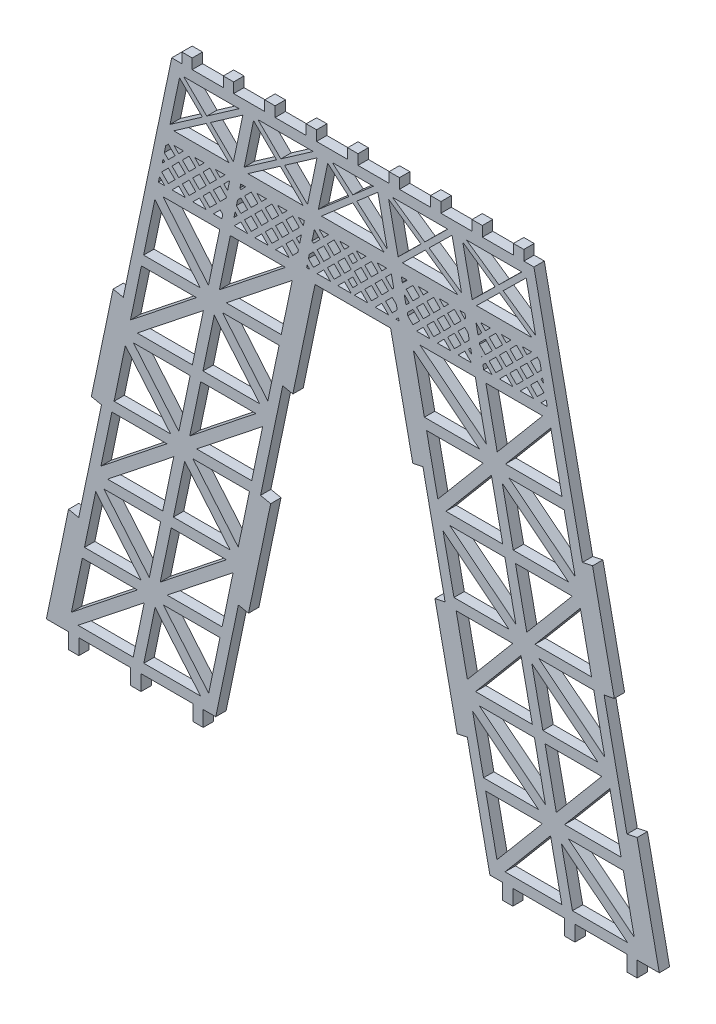
from build123d import *

# Parameters (mm, degrees)
BOSS_EXTRUDE1_DEPTH = 3


with BuildPart() as part:
    # Sketch1 → Boss-Extrude1 (new body)
    with BuildSketch(Plane.XY):
        Polygon((361.579902994, 294.067183599), (358.644817007, 294.067183599), (358.644817007, 297), (355.644817007, 297), (355.644817007, 294.067183598), (346.644817007, 294.067183598), (346.644817007, 297), (343.644817007, 297), (343.644817007, 294.067183598), (334.644817007, 294.067183598), (334.644817007, 297), (331.644817007, 297), (331.644817007, 294.067183598), (322.644817007, 294.067183598), (322.644817007, 297), (319.644817007, 297), (319.644817007, 294.067183598), (310.644817007, 294.067183598), (310.644817007, 297), (307.644817007, 297), (307.644817007, 294.067183598), (298.644817007, 294.067183598), (298.644817007, 297), (295.644817007, 297), (295.644817007, 294.067183598), (286.644817007, 294.067183598), (286.644817007, 297), (283.644817007, 297), (283.644817007, 294.067183598), (274.644817007, 294.067183598), (274.644817007, 297), (271.644817007, 297), (271.644817007, 294.067183599), (262.644817007, 294.067183599), (262.644817007, 297), (259.644817007, 297), (259.644817007, 294.067183599), (256.709731019, 294.067183599), (242.684226302, 227.008009418), (239.747765455, 227.622173639), (233.452582189, 197.523449951), (236.389043037, 196.90928573), (229.786777661, 165.342331618), (226.850316814, 165.956495839), (220.426680383, 135.24360793), (226.839180383, 135.24360793), (226.839180383, 130.74360793), (229.839180383, 130.74360793), (229.839180383, 135.24360793), (244.839180383, 135.24360793), (244.839180383, 130.74360793), (247.839180384, 130.74360793), (247.839180384, 135.24360793), (262.839180383, 135.24360793), (262.839180383, 130.74360793), (265.839180383, 130.74360793), (265.839180383, 135.24360793), (269.465304589, 135.24360793), (276.012418501, 166.546870169), (278.948879348, 165.932705948), (285.367540095, 196.621803965), (282.431079247, 197.235968186), (288.849739994, 227.925066204), (291.786200841, 227.310901983), (298.204861588, 258), (320.084772425, 258), (326.503433172, 227.310901983), (329.439894019, 227.925066204), (335.858554766, 197.235968186), (332.922093918, 196.621803965), (339.340754665, 165.932705948), (342.277215512, 166.546870169), (348.824329424, 135.24360793), (352.450453629, 135.24360793), (352.450453629, 130.74360793), (355.450453629, 130.74360793), (355.450453629, 135.24360793), (370.450453629, 135.24360793), (370.450453629, 130.74360793), (373.450453629, 130.74360793), (373.450453629, 135.24360793), (388.450453629, 135.24360793), (388.450453629, 130.74360793), (391.450453629, 130.74360793), (391.450453629, 135.24360793), (397.862953629, 135.24360793), (391.439317199, 165.956495839), (388.502856351, 165.342331618), (381.900590976, 196.90928573), (384.837051823, 197.523449951), (378.541868558, 227.622173639), (375.605407711, 227.008009418), align=None)
        Polygon((245.573445995, 138.24360793), (229.596770487, 138.24360793), (248.753537524, 153.448359276), align=None, mode=Mode.SUBTRACT)
        Polygon((246.768595166, 155.703006608), (227.664221537, 140.539839979), (230.835615573, 155.703006608), align=None, mode=Mode.SUBTRACT)
        Polygon((265.067303387, 138.24360793), (248.638360008, 138.24360793), (251.908473596, 153.878775512), align=None, mode=Mode.SUBTRACT)
        Polygon((254.294250277, 155.703006608), (270.67949774, 155.703006608), (267.418081645, 140.109423744), align=None, mode=Mode.SUBTRACT)
        Polygon((247.848316546, 158.703006608), (231.463069083, 158.703006608), (234.724485178, 174.296589473), align=None, mode=Mode.SUBTRACT)
        Polygon((237.075263436, 176.162405287), (253.504206815, 176.162405287), (250.234093227, 160.527237705), align=None, mode=Mode.SUBTRACT)
        Polygon((253.389029299, 160.95765394), (256.569120828, 176.162405287), (272.545796335, 176.162405287), align=None, mode=Mode.SUBTRACT)
        Polygon((274.478345286, 173.866173237), (271.306951249, 158.703006608), (255.373971657, 158.703006608), align=None, mode=Mode.SUBTRACT)
        Polygon((238.154984816, 179.162405287), (257.311751853, 194.367156633), (254.131660324, 179.162405287), align=None, mode=Mode.SUBTRACT)
        Polygon((255.326809495, 196.621803965), (236.222435866, 181.458637336), (239.393829902, 196.621803965), align=None, mode=Mode.SUBTRACT)
        Polygon((256.406530875, 199.621803965), (240.021283411, 199.621803965), (243.282699507, 215.21538683), align=None, mode=Mode.SUBTRACT)
        Polygon((245.633477765, 217.081202644), (262.062421144, 217.081202644), (258.792307556, 201.446035062), align=None, mode=Mode.SUBTRACT)
        Polygon((273.625517716, 179.162405287), (257.196574337, 179.162405287), (260.466687925, 194.797572868), align=None, mode=Mode.SUBTRACT)
        Polygon((279.237712069, 196.621803965), (275.976295974, 181.028221101), (262.852464606, 196.621803965), align=None, mode=Mode.SUBTRACT)
        Polygon((283.036559615, 214.784970594), (279.865165578, 199.621803965), (263.932185986, 199.621803965), align=None, mode=Mode.SUBTRACT)
        Polygon((261.947243628, 201.876451297), (265.127335157, 217.081202643), (281.104010664, 217.081202643), align=None, mode=Mode.SUBTRACT)
        Polygon((362.915662355, 158.703006608), (346.982682763, 158.703006608), (343.811288727, 173.866173237), align=None, mode=Mode.SUBTRACT)
        Polygon((366.381160417, 153.878775511), (369.651274005, 138.24360793), (353.222330625, 138.24360793), align=None, mode=Mode.SUBTRACT)
        Polygon((347.610136272, 155.703006608), (363.995383736, 155.703006608), (350.871552368, 140.109423744), align=None, mode=Mode.SUBTRACT)
        Polygon((372.716188017, 138.24360793), (369.536096489, 153.448359276), (388.692863525, 138.24360793), align=None, mode=Mode.SUBTRACT)
        Polygon((390.625412475, 140.539839979), (371.521038847, 155.703006608), (387.454018439, 155.703006608), align=None, mode=Mode.SUBTRACT)
        Polygon((345.743837677, 176.162405287), (361.720513185, 176.162405287), (364.900604713, 160.95765394), align=None, mode=Mode.SUBTRACT)
        Polygon((368.055540785, 160.527237705), (364.785427198, 176.162405286), (381.214370577, 176.162405286), align=None, mode=Mode.SUBTRACT)
        Polygon((386.82656493, 158.703006608), (370.441317466, 158.703006608), (383.565148834, 174.296589472), align=None, mode=Mode.SUBTRACT)
        Polygon((357.822946088, 194.797572868), (361.093059676, 179.162405286), (344.664116297, 179.162405286), align=None, mode=Mode.SUBTRACT)
        Polygon((339.051921944, 196.621803965), (355.437169407, 196.621803965), (342.313338039, 181.0282211), align=None, mode=Mode.SUBTRACT)
        Polygon((354.357448027, 199.621803965), (338.424468435, 199.621803965), (335.253074398, 214.784970594), align=None, mode=Mode.SUBTRACT)
        Polygon((337.185623348, 217.081202643), (353.162298856, 217.081202643), (356.342390385, 201.876451297), align=None, mode=Mode.SUBTRACT)
        Polygon((364.157973689, 179.162405286), (360.97788216, 194.367156633), (380.134649196, 179.162405286), align=None, mode=Mode.SUBTRACT)
        Polygon((382.067198147, 181.458637336), (362.962824518, 196.621803965), (378.89580411, 196.621803965), align=None, mode=Mode.SUBTRACT)
        Polygon((359.497326457, 201.446035062), (356.227212869, 217.081202643), (372.656156248, 217.081202643), align=None, mode=Mode.SUBTRACT)
        Polygon((378.268350601, 199.621803965), (361.883103138, 199.621803965), (375.006934506, 215.215386829), align=None, mode=Mode.SUBTRACT)
        Polygon((246.713199145, 220.081202644), (265.869966181, 235.28595399), (262.689874653, 220.081202644), align=None, mode=Mode.SUBTRACT)
        Polygon((263.885023824, 237.540601322), (244.780650195, 222.377434693), (247.952044231, 237.540601322), align=None, mode=Mode.SUBTRACT)
        Polygon((264.964745204, 240.540601322), (248.57949774, 240.540601322), (251.840913836, 256.134184186), align=None, mode=Mode.SUBTRACT)
        Polygon((254.191692094, 258), (270.620635473, 258), (267.350521885, 242.364832419), align=None, mode=Mode.SUBTRACT)
        Polygon((282.183732045, 220.081202643), (265.754788666, 220.081202643), (269.024902253, 235.716370225), align=None, mode=Mode.SUBTRACT)
        Polygon((287.795926398, 237.540601322), (284.534510302, 221.947018457), (271.410678934, 237.540601322), align=None, mode=Mode.SUBTRACT)
        Polygon((291.594773943, 255.703767951), (288.423379907, 240.540601322), (272.490400315, 240.540601322), align=None, mode=Mode.SUBTRACT)
        Polygon((270.505457957, 242.795248654), (273.685549485, 258), (289.662224993, 258), align=None, mode=Mode.SUBTRACT)
        Polygon((252.858604905, 261), (253.17392681, 262.507626783), (254.681553592, 261), align=None, mode=Mode.SUBTRACT)
        Polygon((260.681553592, 261), (256.802873936, 261), (258.742213764, 262.939339828), align=None, mode=Mode.SUBTRACT)
        Polygon((253.802873936, 264), (255.742213764, 265.939339828), (257.681553592, 264), (255.742213764, 262.060660172), align=None, mode=Mode.SUBTRACT)
        Polygon((266.681553592, 261), (262.802873936, 261), (264.742213764, 262.939339828), align=None, mode=Mode.SUBTRACT)
        Polygon((259.802873936, 264), (261.742213764, 265.939339828), (263.681553592, 264), (261.742213764, 262.060660172), align=None, mode=Mode.SUBTRACT)
        Polygon((253.963285261, 266.281731669), (254.211768107, 267.469785486), (254.681553592, 267), align=None, mode=Mode.SUBTRACT)
        Polygon((256.802873936, 267), (258.742213764, 268.939339828), (260.681553592, 267), (258.742213764, 265.060660172), align=None, mode=Mode.SUBTRACT)
        Polygon((254.578700416, 269.22417352), (254.989057009, 271.186183073), (255.742213764, 271.939339828), (257.681553592, 270), (255.742213764, 268.060660172), align=None, mode=Mode.SUBTRACT)
        Polygon((262.802873936, 267), (264.742213764, 268.939339829), (266.681553592, 267), (264.742213764, 265.060660172), align=None, mode=Mode.SUBTRACT)
        Polygon((259.802873936, 270), (261.742213764, 271.939339828), (263.681553592, 270), (261.742213764, 268.060660172), align=None, mode=Mode.SUBTRACT)
        Polygon((257.365930865, 272.436943071), (260.118496663, 272.436943071), (258.742213764, 271.060660172), align=None, mode=Mode.SUBTRACT)
        Polygon((263.365930865, 272.436943071), (266.118496663, 272.436943071), (264.742213764, 271.060660172), align=None, mode=Mode.SUBTRACT)
        Polygon((256.233730518, 277.137254306), (258.964714028, 290.19471659), (265.603222098, 283.665985448), align=None, mode=Mode.SUBTRACT)
        Polygon((271.248088982, 261), (268.802873936, 261), (270.742213764, 262.939339828), (271.496040443, 262.185513149), align=None, mode=Mode.SUBTRACT)
        Polygon((265.802873936, 264), (267.742213764, 265.939339828), (269.681553592, 264), (267.742213764, 262.060660172), align=None, mode=Mode.SUBTRACT)
        Polygon((271.802873936, 264), (271.894760719, 264.091886783), (271.862972753, 263.939901183), align=None, mode=Mode.SUBTRACT)
        Polygon((275.681553592, 264), (274.744462886, 263.062909294), (275.068646697, 264.612906895), align=None, mode=Mode.SUBTRACT)
        Polygon((278.681553592, 261), (274.802873936, 261), (276.742213764, 262.939339828), align=None, mode=Mode.SUBTRACT)
        Polygon((277.802873936, 264), (279.742213764, 265.939339828), (281.681553592, 264), (279.742213764, 262.060660172), align=None, mode=Mode.SUBTRACT)
        Polygon((284.681553592, 261), (280.802873936, 261), (282.742213764, 262.939339828), align=None, mode=Mode.SUBTRACT)
        Polygon((283.802873936, 264), (285.742213764, 265.939339828), (287.681553592, 264), (285.742213764, 262.060660172), align=None, mode=Mode.SUBTRACT)
        Polygon((265.802873936, 270), (267.742213764, 271.939339828), (269.681553592, 270), (267.742213764, 268.060660172), align=None, mode=Mode.SUBTRACT)
        Polygon((268.802873936, 267), (270.742213764, 268.939339828), (272.53388174, 267.147671852), (272.455773916, 266.774220324), (270.742213764, 265.060660172), align=None, mode=Mode.SUBTRACT)
        Polygon((271.802873936, 270), (273.481545664, 271.678671729), (272.90081405, 268.902059886), align=None, mode=Mode.SUBTRACT)
        Polygon((269.365930865, 272.436943071), (272.118496663, 272.436943071), (270.742213764, 271.060660172), align=None, mode=Mode.SUBTRACT)
        Polygon((275.435579007, 266.367294929), (275.770234634, 267.967360698), (276.742213764, 268.939339828), (278.681553592, 267), (276.742213764, 265.060660172), align=None, mode=Mode.SUBTRACT)
        Polygon((277.802873936, 270), (279.742213764, 271.939339828), (281.681553592, 270), (279.742213764, 268.060660172), align=None, mode=Mode.SUBTRACT)
        Polygon((280.802873936, 267), (282.742213764, 268.939339828), (284.681553592, 267), (282.742213764, 265.060660172), align=None, mode=Mode.SUBTRACT)
        Polygon((283.802873936, 270), (285.742213764, 271.939339828), (287.681553592, 270), (285.742213764, 268.060660172), align=None, mode=Mode.SUBTRACT)
        Polygon((276.473420304, 271.329453632), (276.705053015, 272.436943071), (278.118496663, 272.436943071), (276.742213764, 271.060660172), align=None, mode=Mode.SUBTRACT)
        Polygon((281.365930865, 272.436943071), (284.118496663, 272.436943071), (282.742213764, 271.060660172), align=None, mode=Mode.SUBTRACT)
        Polygon((290.681553592, 261), (286.802873936, 261), (288.742213764, 262.939339828), align=None, mode=Mode.SUBTRACT)
        Polygon((289.802873936, 264), (291.742213764, 265.939339828), (293.390760331, 264.290793261), (293.236951541, 263.555397949), (291.742213764, 262.060660172), align=None, mode=Mode.SUBTRACT)
        Polygon((296.681553592, 261), (295.767401084, 261), (295.925525288, 261.756028304), align=None, mode=Mode.SUBTRACT)
        Polygon((296.292457598, 263.510416338), (296.551412259, 264.748538323), (297.742213764, 265.939339828), (299.681553592, 264), (297.742213764, 262.060660172), align=None, mode=Mode.SUBTRACT)
        Polygon((302.681553592, 261), (298.802873936, 261), (300.742213764, 262.939339828), align=None, mode=Mode.SUBTRACT)
        Polygon((308.681553592, 261), (304.802873936, 261), (306.742213764, 262.939339828), align=None, mode=Mode.SUBTRACT)
        Polygon((301.802873936, 264), (303.742213764, 265.939339828), (305.681553592, 264), (303.742213764, 262.060660172), align=None, mode=Mode.SUBTRACT)
        Polygon((286.802873936, 267), (288.742213764, 268.939339828), (290.681553592, 267), (288.742213764, 265.060660172), align=None, mode=Mode.SUBTRACT)
        Polygon((289.802873936, 270), (291.742213764, 271.939339828), (293.681553592, 270), (291.742213764, 268.060660172), align=None, mode=Mode.SUBTRACT)
        Polygon((292.802873936, 267), (294.262723289, 268.459849353), (293.757692641, 266.045181295), align=None, mode=Mode.SUBTRACT)
        Polygon((287.365930865, 272.436943071), (290.118496663, 272.436943071), (288.742213764, 271.060660172), align=None, mode=Mode.SUBTRACT)
        Polygon((293.365930865, 272.436943071), (295.094537092, 272.436943071), (294.823736487, 271.142182895), (294.742213764, 271.060660172), align=None, mode=Mode.SUBTRACT)
        Polygon((298.802873936, 267), (300.742213764, 268.939339828), (302.681553592, 267), (300.742213764, 265.060660172), align=None, mode=Mode.SUBTRACT)
        Polygon((297.330298895, 268.472575041), (298.001207882, 271.68034571), (299.681553592, 270), (297.742213764, 268.060660172), align=None, mode=Mode.SUBTRACT)
        Polygon((306.742213764, 268.939339828), (308.681553592, 267), (306.742213764, 265.060660172), (304.802873936, 267), align=None, mode=Mode.SUBTRACT)
        Polygon((305.681553592, 270), (303.742213764, 268.060660172), (301.802873936, 270), (303.742213764, 271.939339828), align=None, mode=Mode.SUBTRACT)
        Polygon((299.365930865, 272.436943071), (302.118496663, 272.436943071), (300.742213764, 271.060660172), align=None, mode=Mode.SUBTRACT)
        Polygon((305.365930865, 272.436943071), (308.118496663, 272.436943071), (306.742213764, 271.060660172), align=None, mode=Mode.SUBTRACT)
        Polygon((273.329793511, 276.067183598), (257.321793861, 276.067183599), (266.691285441, 282.595914741), align=None, mode=Mode.SUBTRACT)
        Polygon((267.94337748, 283.468381749), (277.31286906, 289.997112891), (274.58188555, 276.939650607), align=None, mode=Mode.SUBTRACT)
        Polygon((294.784191601, 276.067183598), (278.77619195, 276.067183599), (288.14568353, 282.59591474), align=None, mode=Mode.SUBTRACT)
        Polygon((287.057620188, 283.665985448), (277.688128608, 277.137254306), (280.419112118, 290.19471659), align=None, mode=Mode.SUBTRACT)
        Polygon((260.216806067, 291.067183599), (276.224805718, 291.067183599), (266.855314138, 284.538452457), align=None, mode=Mode.SUBTRACT)
        Polygon((289.39777557, 283.468381749), (298.76726715, 289.997112891), (296.03628364, 276.939650607), align=None, mode=Mode.SUBTRACT)
        Polygon((307.999384045, 284.926098235), (299.172184411, 277.279054677), (301.880283829, 290.227102839), align=None, mode=Mode.SUBTRACT)
        Polygon((281.671204157, 291.067183598), (297.679203807, 291.067183598), (288.309712227, 284.538452456), align=None, mode=Mode.SUBTRACT)
        Polygon((330.493707615, 237.540601322), (346.878955078, 237.540601322), (333.75512371, 221.947018457), align=None, mode=Mode.SUBTRACT)
        Polygon((349.26473176, 235.716370225), (352.534845347, 220.081202643), (336.105901968, 220.081202643), align=None, mode=Mode.SUBTRACT)
        Polygon((345.799233698, 240.540601322), (329.866254106, 240.540601322), (326.69486007, 255.703767951), align=None, mode=Mode.SUBTRACT)
        Polygon((328.62740902, 258), (344.604084528, 258), (347.784176056, 242.795248654), align=None, mode=Mode.SUBTRACT)
        Polygon((355.59975936, 220.081202643), (352.419667831, 235.285953989), (371.576434868, 220.081202643), align=None, mode=Mode.SUBTRACT)
        Polygon((373.508983818, 222.377434692), (354.404610189, 237.540601322), (370.337589782, 237.540601322), align=None, mode=Mode.SUBTRACT)
        Polygon((350.939112128, 242.364832418), (347.66899854, 258), (364.097941919, 258), align=None, mode=Mode.SUBTRACT)
        Polygon((369.710136273, 240.540601322), (353.324888809, 240.540601322), (366.448720177, 256.134184186), align=None, mode=Mode.SUBTRACT)
        Polygon((309.608080421, 261), (311.547420249, 262.939339828), (313.486760077, 261), align=None, mode=Mode.SUBTRACT)
        Polygon((310.486760077, 264), (309.144817007, 262.65805693), (307.802873936, 264), (309.144817007, 265.341943071), align=None, mode=Mode.SUBTRACT)
        Polygon((312.608080421, 264), (314.547420249, 265.939339828), (316.486760077, 264), (314.547420249, 262.060660172), align=None, mode=Mode.SUBTRACT)
        Polygon((315.608080421, 261), (317.547420249, 262.939339828), (319.486760077, 261), align=None, mode=Mode.SUBTRACT)
        Polygon((322.364108725, 261.756028304), (322.522232929, 261), (321.608080421, 261), align=None, mode=Mode.SUBTRACT)
        Polygon((320.547420249, 265.939339828), (321.738221754, 264.748538323), (321.997176415, 263.510416338), (320.547420249, 262.060660172), (318.608080421, 264), align=None, mode=Mode.SUBTRACT)
        Polygon((327.608080421, 261), (329.547420249, 262.939339828), (331.486760077, 261), align=None, mode=Mode.SUBTRACT)
        Polygon((324.898873682, 264.290793261), (326.547420249, 265.939339828), (328.486760077, 264), (326.547420249, 262.060660172), (325.052682472, 263.555397949), align=None, mode=Mode.SUBTRACT)
        Polygon((311.547420249, 265.060660172), (309.608080421, 267), (311.547420249, 268.939339828), (313.486760077, 267), align=None, mode=Mode.SUBTRACT)
        Polygon((307.802873936, 270), (309.144817007, 271.341943071), (310.486760077, 270), (309.144817006, 268.65805693), align=None, mode=Mode.SUBTRACT)
        Polygon((316.486760077, 270), (314.547420249, 268.060660172), (312.608080421, 270), (314.547420249, 271.939339828), align=None, mode=Mode.SUBTRACT)
        Polygon((315.608080421, 267), (317.547420249, 268.939339828), (319.486760077, 267), (317.547420249, 265.060660172), align=None, mode=Mode.SUBTRACT)
        Polygon((318.608080421, 270), (320.288426131, 271.68034571), (320.959335118, 268.472575041), (320.547420249, 268.060660172), align=None, mode=Mode.SUBTRACT)
        Polygon((311.547420249, 271.060660172), (310.17113735, 272.436943071), (312.923703148, 272.436943071), align=None, mode=Mode.SUBTRACT)
        Polygon((317.547420249, 271.060660172), (316.17113735, 272.436943071), (318.923703148, 272.436943071), align=None, mode=Mode.SUBTRACT)
        Polygon((324.531941372, 266.045181295), (324.026910724, 268.459849353), (325.486760077, 267), align=None, mode=Mode.SUBTRACT)
        Polygon((327.608080421, 267), (329.547420249, 268.939339828), (331.486760077, 267), (329.547420249, 265.060660172), align=None, mode=Mode.SUBTRACT)
        Polygon((324.608080421, 270), (326.547420249, 271.939339828), (328.486760077, 270), (326.547420249, 268.060660172), align=None, mode=Mode.SUBTRACT)
        Polygon((323.465897526, 271.142182894), (323.195096921, 272.436943071), (324.923703148, 272.436943071), (323.547420249, 271.060660172), align=None, mode=Mode.SUBTRACT)
        Polygon((329.547420249, 271.060660172), (328.17113735, 272.436943071), (330.923703148, 272.436943071), align=None, mode=Mode.SUBTRACT)
        Polygon((333.608080421, 261), (335.547420249, 262.939339828), (337.486760077, 261), align=None, mode=Mode.SUBTRACT)
        Polygon((330.608080421, 264), (332.547420249, 265.939339828), (334.486760077, 264), (332.547420249, 262.060660172), align=None, mode=Mode.SUBTRACT)
        Polygon((339.608080421, 261), (341.547420249, 262.939339828), (343.486760077, 261), align=None, mode=Mode.SUBTRACT)
        Polygon((336.608080421, 264), (338.547420249, 265.939339828), (340.486760077, 264), (338.547420249, 262.060660172), align=None, mode=Mode.SUBTRACT)
        Polygon((343.220987316, 264.612906895), (343.545171127, 263.062909294), (342.608080421, 264), align=None, mode=Mode.SUBTRACT)
        Polygon((346.42666126, 263.939901183), (346.394873294, 264.091886783), (346.486760077, 264), align=None, mode=Mode.SUBTRACT)
        Polygon((346.79359357, 262.185513149), (347.547420249, 262.939339828), (349.486760077, 261), (347.041545031, 261), align=None, mode=Mode.SUBTRACT)
        Polygon((348.608080421, 264), (350.547420249, 265.939339828), (352.486760077, 264), (350.547420249, 262.060660172), align=None, mode=Mode.SUBTRACT)
        Polygon((333.608080421, 267), (335.547420249, 268.939339828), (337.486760077, 267), (335.547420249, 265.060660172), align=None, mode=Mode.SUBTRACT)
        Polygon((330.608080421, 270), (332.547420249, 271.939339828), (334.486760077, 270), (332.547420249, 268.060660172), align=None, mode=Mode.SUBTRACT)
        Polygon((341.547420249, 268.939339828), (342.519399379, 267.967360698), (342.854055006, 266.367294929), (341.547420249, 265.060660172), (339.608080421, 267), align=None, mode=Mode.SUBTRACT)
        Polygon((336.608080421, 270), (338.547420249, 271.939339828), (340.486760077, 270), (338.547420249, 268.060660172), align=None, mode=Mode.SUBTRACT)
        Polygon((335.547420249, 271.060660172), (334.17113735, 272.436943071), (336.923703148, 272.436943071), align=None, mode=Mode.SUBTRACT)
        Polygon((340.17113735, 272.436943071), (341.584580998, 272.436943071), (341.816213709, 271.329453632), (341.547420249, 271.060660172), align=None, mode=Mode.SUBTRACT)
        Polygon((345.755752273, 267.147671852), (347.547420249, 268.939339828), (349.486760077, 267), (347.547420249, 265.060660172), (345.833860097, 266.774220324), align=None, mode=Mode.SUBTRACT)
        Polygon((345.388819963, 268.902059886), (344.808088349, 271.678671728), (346.486760077, 270), align=None, mode=Mode.SUBTRACT)
        Polygon((348.608080421, 270), (350.547420249, 271.939339828), (352.486760077, 270), (350.547420249, 268.060660172), align=None, mode=Mode.SUBTRACT)
        Polygon((347.547420249, 271.060660172), (346.17113735, 272.436943071), (348.923703148, 272.436943071), align=None, mode=Mode.SUBTRACT)
        Polygon((300.064153119, 276.067183598), (309.144817007, 283.933804404), (318.225480894, 276.067183598), align=None, mode=Mode.SUBTRACT)
        Polygon((316.409350184, 290.227102839), (319.117449602, 277.279054676), (310.290249968, 284.926098235), align=None, mode=Mode.SUBTRACT)
        Polygon((322.253350373, 276.939650607), (319.522366863, 289.997112891), (328.891858443, 283.468381749), align=None, mode=Mode.SUBTRACT)
        Polygon((303.201420664, 291.067183598), (315.088213349, 291.067183598), (309.144817007, 285.918392067), align=None, mode=Mode.SUBTRACT)
        Polygon((329.979921786, 284.538452456), (320.610430206, 291.067183598), (336.618429856, 291.067183598), align=None, mode=Mode.SUBTRACT)
        Polygon((330.143950483, 282.59591474), (339.513442063, 276.067183598), (323.505442412, 276.067183598), align=None, mode=Mode.SUBTRACT)
        Polygon((337.870521896, 290.19471659), (340.601505405, 277.137254306), (331.232013825, 283.665985448), align=None, mode=Mode.SUBTRACT)
        Polygon((351.598348573, 282.59591474), (360.967840153, 276.067183598), (344.959840502, 276.067183598), align=None, mode=Mode.SUBTRACT)
        Polygon((343.707748463, 276.939650607), (340.976764953, 289.997112891), (350.346256533, 283.468381749), align=None, mode=Mode.SUBTRACT)
        Polygon((351.434319876, 284.538452456), (342.064828296, 291.067183598), (358.072827946, 291.067183598), align=None, mode=Mode.SUBTRACT)
        Polygon((351.608080421, 261), (353.547420249, 262.939339828), (355.486760077, 261), align=None, mode=Mode.SUBTRACT)
        Polygon((354.608080421, 264), (356.547420249, 265.939339828), (358.486760077, 264), (356.547420249, 262.060660172), align=None, mode=Mode.SUBTRACT)
        Polygon((357.608080421, 261), (359.547420249, 262.939339828), (361.486760077, 261), align=None, mode=Mode.SUBTRACT)
        Polygon((363.608080421, 261), (365.115707203, 262.507626783), (365.431029108, 261), align=None, mode=Mode.SUBTRACT)
        Polygon((360.608080421, 264), (362.547420249, 265.939339828), (364.486760077, 264), (362.547420249, 262.060660172), align=None, mode=Mode.SUBTRACT)
        Polygon((351.608080421, 267), (353.547420249, 268.939339828), (355.486760077, 267), (353.547420249, 265.060660172), align=None, mode=Mode.SUBTRACT)
        Polygon((354.608080421, 270), (356.547420249, 271.939339828), (358.486760077, 270), (356.547420249, 268.060660172), align=None, mode=Mode.SUBTRACT)
        Polygon((357.608080421, 267), (359.547420249, 268.939339828), (361.486760077, 267), (359.547420249, 265.060660172), align=None, mode=Mode.SUBTRACT)
        Polygon((364.326348752, 266.281731669), (363.608080421, 267), (364.077865906, 267.469785486), align=None, mode=Mode.SUBTRACT)
        Polygon((362.547420249, 271.939339828), (363.300577004, 271.186183073), (363.710933597, 269.22417352), (362.547420249, 268.060660172), (360.608080421, 270), align=None, mode=Mode.SUBTRACT)
        Polygon((353.547420249, 271.060660172), (352.17113735, 272.436943071), (354.923703148, 272.436943071), align=None, mode=Mode.SUBTRACT)
        Polygon((359.547420249, 271.060660172), (358.17113735, 272.436943071), (360.923703148, 272.436943071), align=None, mode=Mode.SUBTRACT)
        Polygon((362.055903495, 277.137254306), (352.686411915, 283.665985448), (359.324919985, 290.19471659), align=None, mode=Mode.SUBTRACT)
    extrude(amount=BOSS_EXTRUDE1_DEPTH)


solid = part.part
